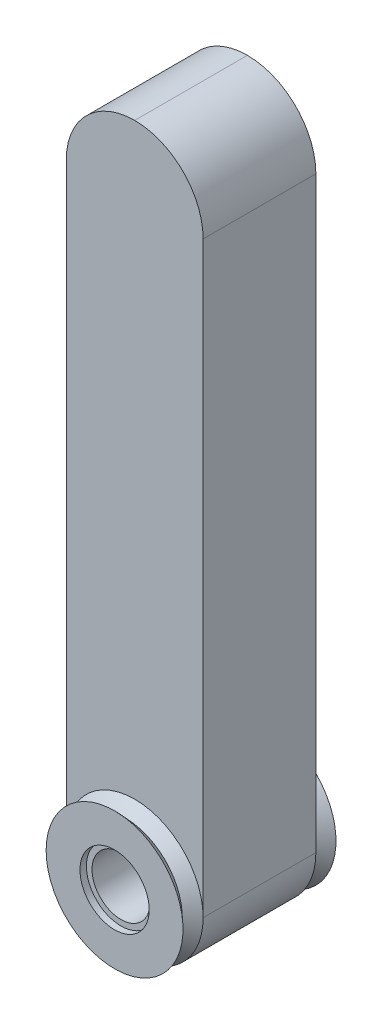
from build123d import *

# Parameters (mm, degrees)
SKETCH_1_W          = 17
SKETCH_1_H          = 90
SKETCH_1_R          = 3.6
EXTRUDE_1_DEPTH     = 7
FILLET_1_R          = 8.5
SKETCH_2_R          = 8.5
SKETCH_2_R_2        = 3.6
EXTRUDE_2_DEPTH     = 2.5
SKETCH_4_R          = 4.3
CUT_EXTRUDE_1_DEPTH = 0.8


with BuildPart() as part:
    # 스케치1 → 보스-돌출1 (new, symmetric)
    with BuildSketch(Plane.XY):
        Rectangle(SKETCH_1_W, SKETCH_1_H)
        with Locations((0, -36.5)):
            Circle(SKETCH_1_R, mode=Mode.SUBTRACT)
    extrude(amount=EXTRUDE_1_DEPTH, both=True)

    # 필렛1
    fillet_1_edges = [part.edges().sort_by_distance(p)[0] for p in [
        (8.5, -45, 0),
        (-8.5, -45, 0),
        (-8.5, 45, 0),
        (8.5, 45, 0),
    ]]
    fillet(fillet_1_edges, radius=FILLET_1_R - 0.0001)  # a hair under: the kernel refuses the full size

    # 스케치2 → 보스-돌출2 (add)
    with BuildSketch(Plane.XY.offset(7)):
        with Locations((0, -36.5)):
            Circle(SKETCH_2_R)
        with Locations((0, -36.5)):
            Circle(SKETCH_2_R_2, mode=Mode.SUBTRACT)
    extrude_2 = extrude(amount=EXTRUDE_2_DEPTH)

    # 스케치3 → 컷-회전1 (revolve, cut)
    with BuildSketch(Plane(origin=(0, 0, 0), x_dir=(0, 0, -1), z_dir=(1, 0, 0)), mode=Mode.PRIVATE) as cut_revolve_1_sk:
        Polygon((-9.5, -28), (-8.25, -29.35), (-7, -28), align=None)
    cut_revolve_1 = revolve(cut_revolve_1_sk.sketch.rotate(Axis((0, -36.5, 0), (0, 0, 1)), 90), axis=Axis((0, -36.5, 0), (0, 0, 1)), mode=Mode.SUBTRACT)

    # 스케치4 → 컷-돌출1 (cut)
    with BuildSketch(Plane.XY.offset(9.5)):
        with Locations((0, -36.5)):
            Circle(SKETCH_4_R)
    cut_extrude_1 = extrude(amount=-CUT_EXTRUDE_1_DEPTH, mode=Mode.SUBTRACT)

    # 대칭 복사1: 보스-돌출2, 컷-회전1, 컷-돌출1 across plane
    add(extrude_2.mirror(Plane.XY))
    add(cut_revolve_1.mirror(Plane.XY), mode=Mode.SUBTRACT)
    add(cut_extrude_1.mirror(Plane.XY), mode=Mode.SUBTRACT)


solid = part.part
